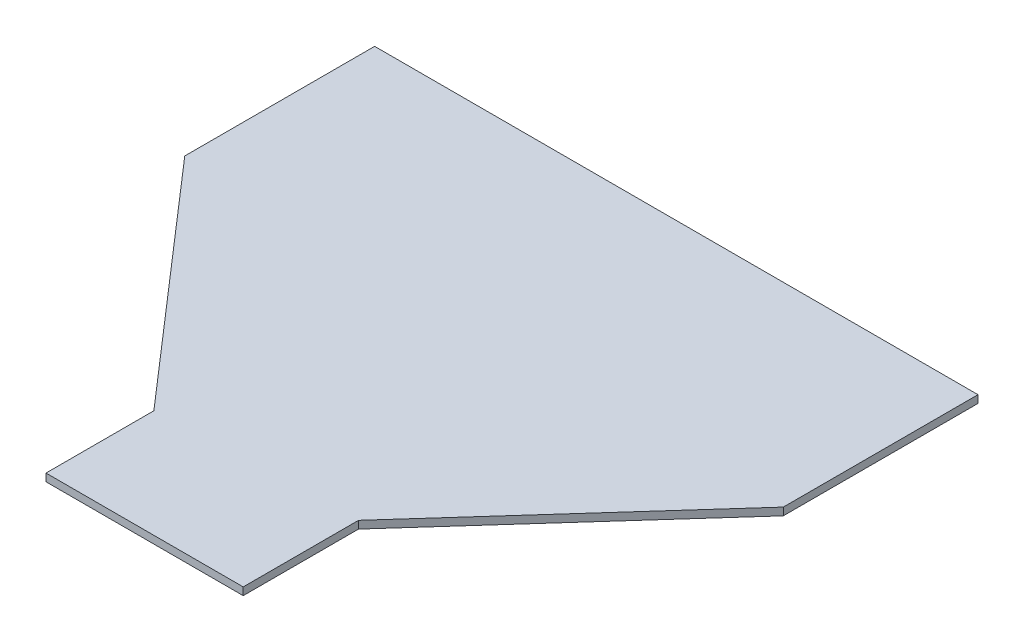
from build123d import *

# Parameters (mm, degrees)
BOSS_EXTRUDE1_DEPTH = 1
BOSS_EXTRUDE2_DEPTH = 1
SKETCH3_W           = 41.815204887
SKETCH3_H           = 29.685729628
CUT_EXTRUDE1_DEPTH  = 10


with BuildPart() as part:
    # Sketch1 → Boss-Extrude1 (new body)
    with BuildSketch(Plane(origin=(0, 0, 0), x_dir=(1, 0, 0), z_dir=(0, 1, 0))):
        Polygon((-17.101249567, 62.026712282), (-17.101249567, 42.026712282), (-44.119439114, 42.026712282), (-44.119439114, 17.026712282), (-4.760262303, -28.259656537), (35.313890805, 16.395267634), (35.313890805, 42.026712282), (8.862371339, 42.026712282), (8.862371339, 62.026712282), align=None)
    extrude(amount=BOSS_EXTRUDE1_DEPTH)

    # Sketch2 → Boss-Extrude2 (add)
    with BuildSketch(Plane(origin=(0, 1, 0), x_dir=(1, 0, 0), z_dir=(0, 1, 0))):
        Polygon((8.862371339, -28.259656537), (-17.101249567, -28.259656537), (-17.101249567, 42.026712282), (8.862371339, 62.026712282), align=None)
    extrude(amount=-BOSS_EXTRUDE2_DEPTH)

    # Sketch3 → Cut-Extrude1 (cut)
    with BuildSketch(Plane(origin=(0, 1, 0), x_dir=(1, 0, 0), z_dir=(0, 1, 0))):
        with Locations((3.806352877, 56.869577096)):
            Rectangle(SKETCH3_W, SKETCH3_H)
    extrude(amount=-CUT_EXTRUDE1_DEPTH, mode=Mode.SUBTRACT)


solid = part.part
